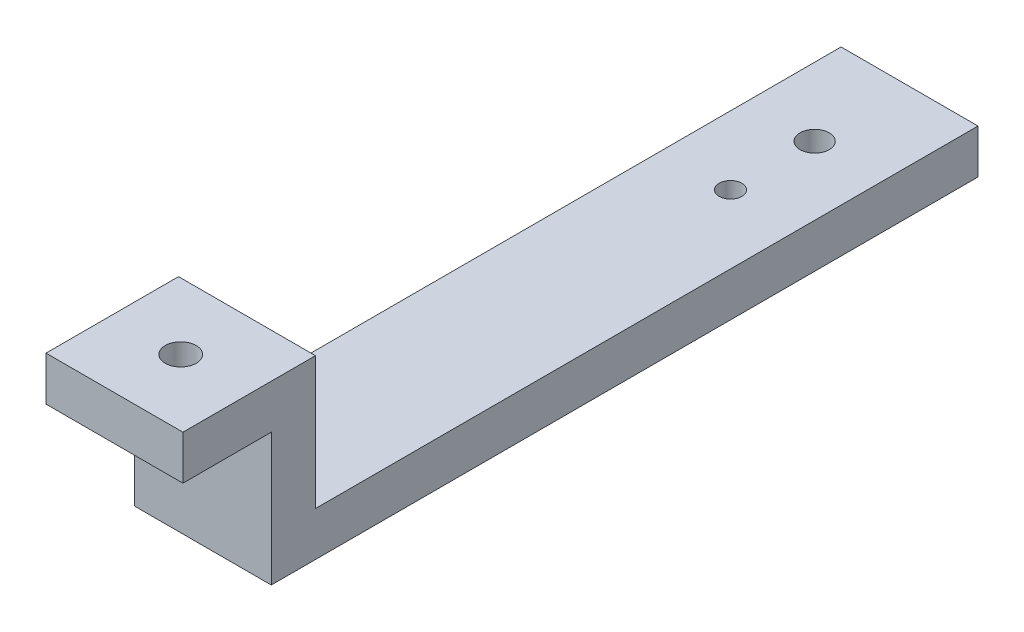
from build123d import *

# Parameters (mm, degrees)
EXTRUDE_THIN1_DEPTH             = 31
SKETCH6_R                       = 3.5
CUT_EXTRUDE1_DEPTH              = 10
SKETCH7_R                       = 3.302
CUT_EXTRUDE3_DEPTH              = 10.16
F_97_0_203_DIAMETER_HOLE1_D     = 5.1562
F_97_0_203_DIAMETER_HOLE1_DEPTH = 25.4
F_97_0_203_DIAMETER_HOLE1_TIP   = 1.549078762


with BuildPart() as part:
    # Sketch1 → Extrude-Thin1 (new body)
    with BuildSketch(Plane(origin=(0, 0, 0), x_dir=(0, 0, -1), z_dir=(1, 0, 0))):
        Polygon((0, 0), (30, 0), (30, -29.972), (180, -29.972), (180, -39.972), (20, -39.972), (20, -10), (0, -10), align=None)
    extrude(amount=EXTRUDE_THIN1_DEPTH)

    # Sketch6 → Cut-Extrude1 (cut)
    with BuildSketch(Plane(origin=(0, 0, 0), x_dir=(1, 0, 0), z_dir=(0, 1, 0))):
        with Locations((15.5, 15)):
            Circle(SKETCH6_R)
    extrude(amount=-CUT_EXTRUDE1_DEPTH, mode=Mode.SUBTRACT)

    # Sketch7 → Cut-Extrude3 (cut)
    with BuildSketch(Plane(origin=(0, -29.972, 0), x_dir=(1, 0, 0), z_dir=(0, 1, 0))):
        with Locations((15.494, 158.524)):
            Circle(SKETCH7_R)
    extrude(amount=-CUT_EXTRUDE3_DEPTH, mode=Mode.SUBTRACT)

    # #97 (0.203) Diameter Hole1
    with Locations(Plane(origin=(0, -29.972, 0), x_dir=(1, 0, 0), z_dir=(0, 1, 0))):
        with Locations((15.494, 139.474)):
            Hole(F_97_0_203_DIAMETER_HOLE1_D / 2, depth=F_97_0_203_DIAMETER_HOLE1_DEPTH)
            with Locations((0, 0, -(F_97_0_203_DIAMETER_HOLE1_DEPTH + F_97_0_203_DIAMETER_HOLE1_TIP / 2))):  # 118° drill point
                Cone(0, F_97_0_203_DIAMETER_HOLE1_D / 2, F_97_0_203_DIAMETER_HOLE1_TIP, mode=Mode.SUBTRACT)


solid = part.part
